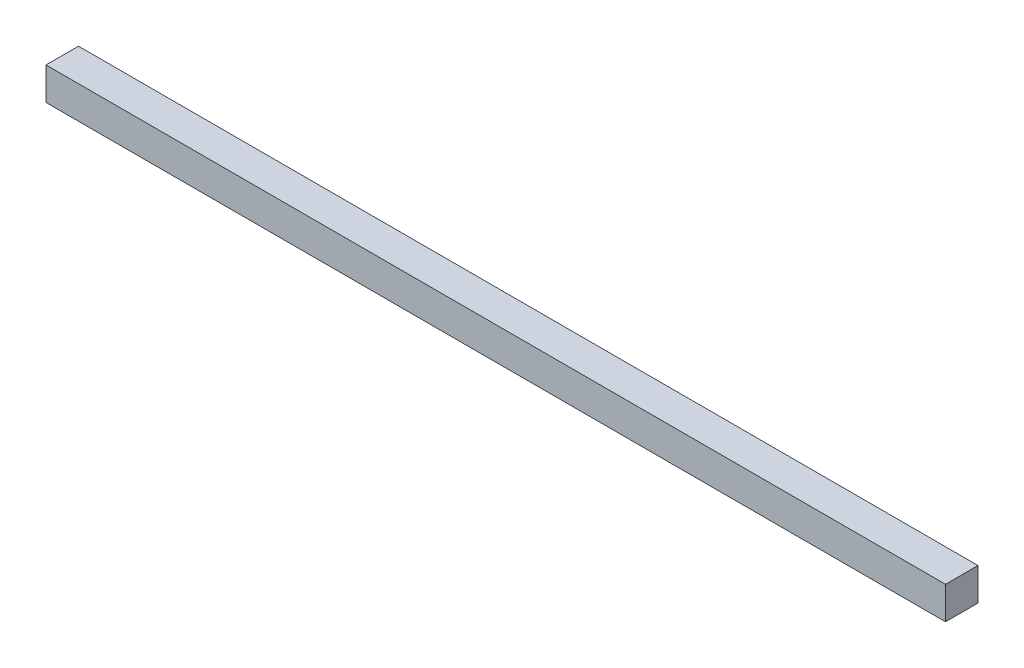
from build123d import *

# Parameters (mm, degrees)
SKETCH_1_W      = 415
SKETCH_1_H      = 15
EXTRUDE_1_DEPTH = 15


with BuildPart() as part:
    # Эскиз1 → Бобышка-Вытянуть1 (new body)
    with BuildSketch(Plane(origin=(0, 0, 0), x_dir=(1, 0, 0), z_dir=(0, 1, 0))):
        with Locations((207.5, 7.5)):
            Rectangle(SKETCH_1_W, SKETCH_1_H)
    extrude(amount=EXTRUDE_1_DEPTH)


solid = part.part
